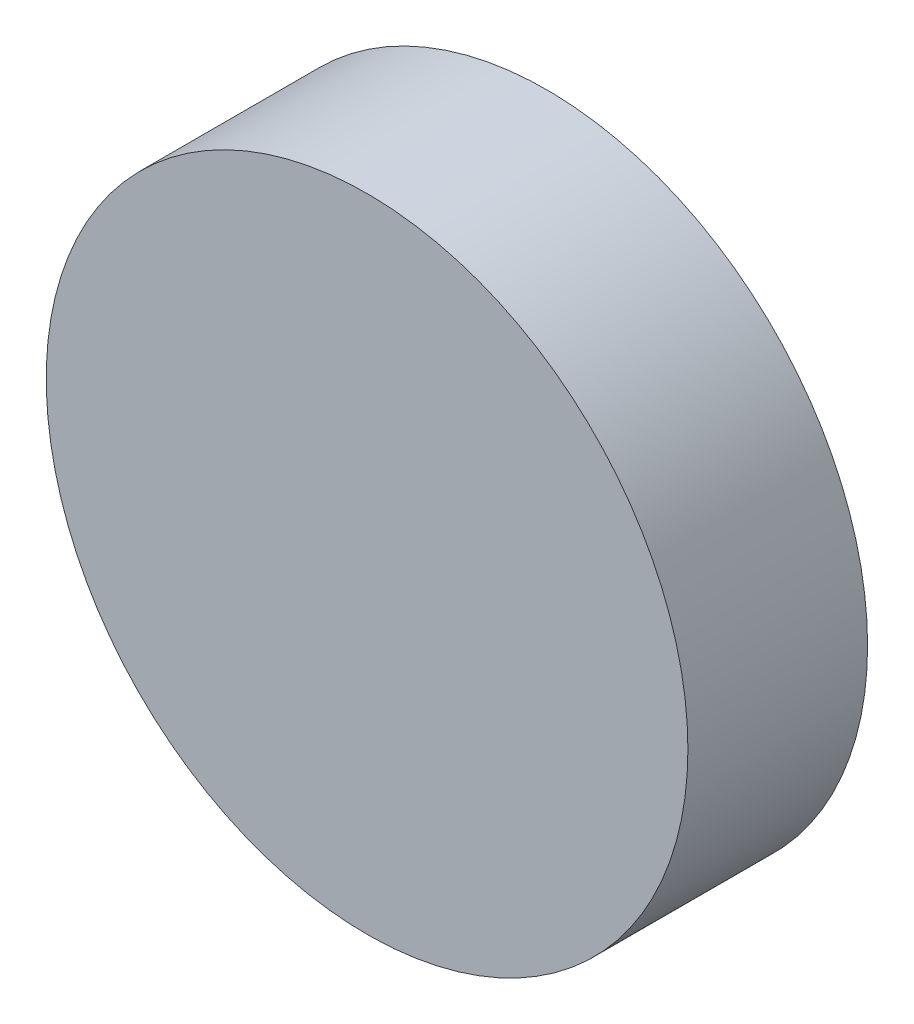
from build123d import *

# Parameters (mm, degrees)
EXTRUDE_125_35_DEPTH      = 17.5
EXTRUDE_125_35_DEPTH_BACK = 17.5
SKETCH_1_R                = 62.5


with BuildPart() as part:
    # Эскиз1 → Колесо Ø125 × 35 (упрощено) (new, two sides: drawn at the far end of the back side and taken through both)
    with BuildSketch(Plane.XY.offset(-EXTRUDE_125_35_DEPTH_BACK)):
        Circle(SKETCH_1_R)
    extrude(amount=EXTRUDE_125_35_DEPTH + EXTRUDE_125_35_DEPTH_BACK)


solid = part.part
